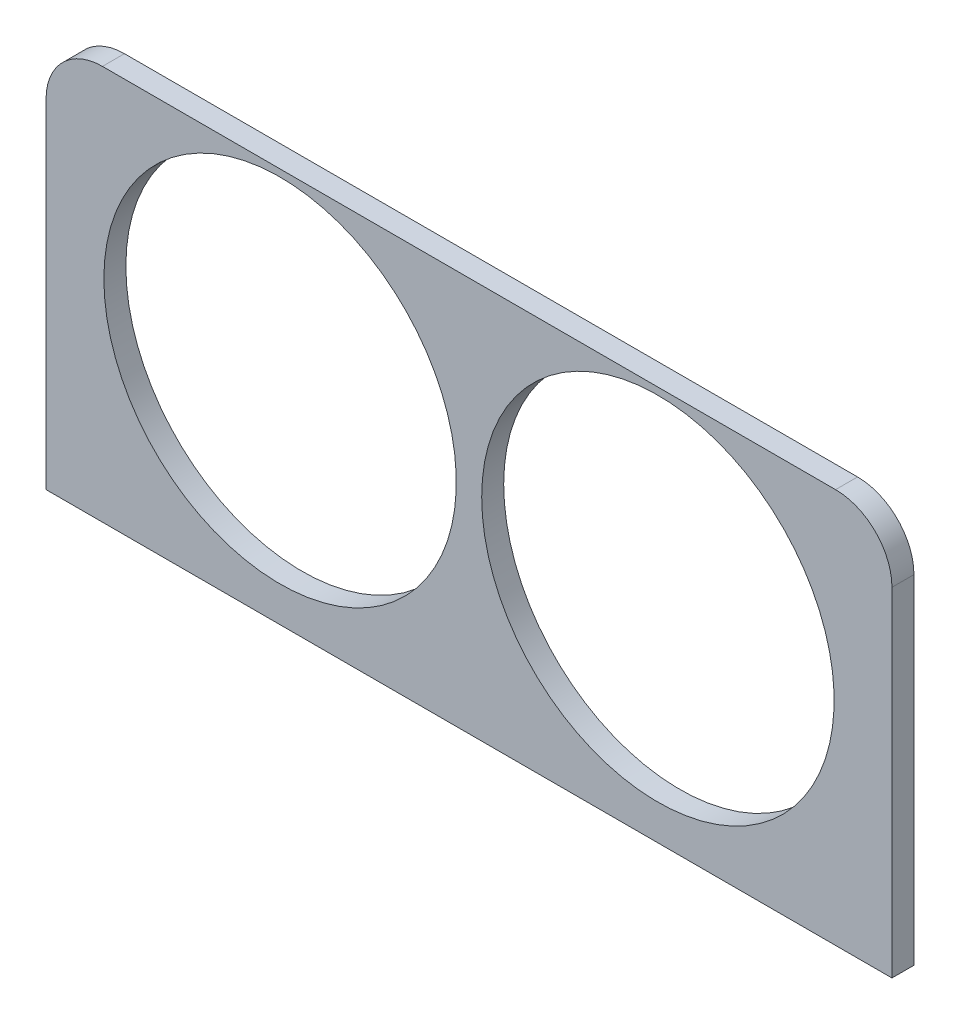
from build123d import *

# Parameters (mm, degrees)
SKETCH1_W           = 30
SKETCH1_H           = 14
SKETCH1_R           = 6.25
BOSS_EXTRUDE1_DEPTH = 0.78
FILLET1_R           = 2


with BuildPart() as part:
    # Sketch1 → Boss-Extrude1 (new body)
    with BuildSketch(Plane.XY):
        Rectangle(SKETCH1_W, SKETCH1_H)
        with Locations((-6.7, 0.5)):
            Circle(SKETCH1_R, mode=Mode.SUBTRACT)
        with Locations((6.7, 0.5)):
            Circle(SKETCH1_R, mode=Mode.SUBTRACT)
    extrude(amount=BOSS_EXTRUDE1_DEPTH)

    # Fillet1
    fillet1_edges = [part.edges().sort_by_distance(p)[0] for p in [
        (15, 7, 0.39),
        (-15, 7, 0.39),
    ]]
    fillet(fillet1_edges, radius=FILLET1_R)


solid = part.part
